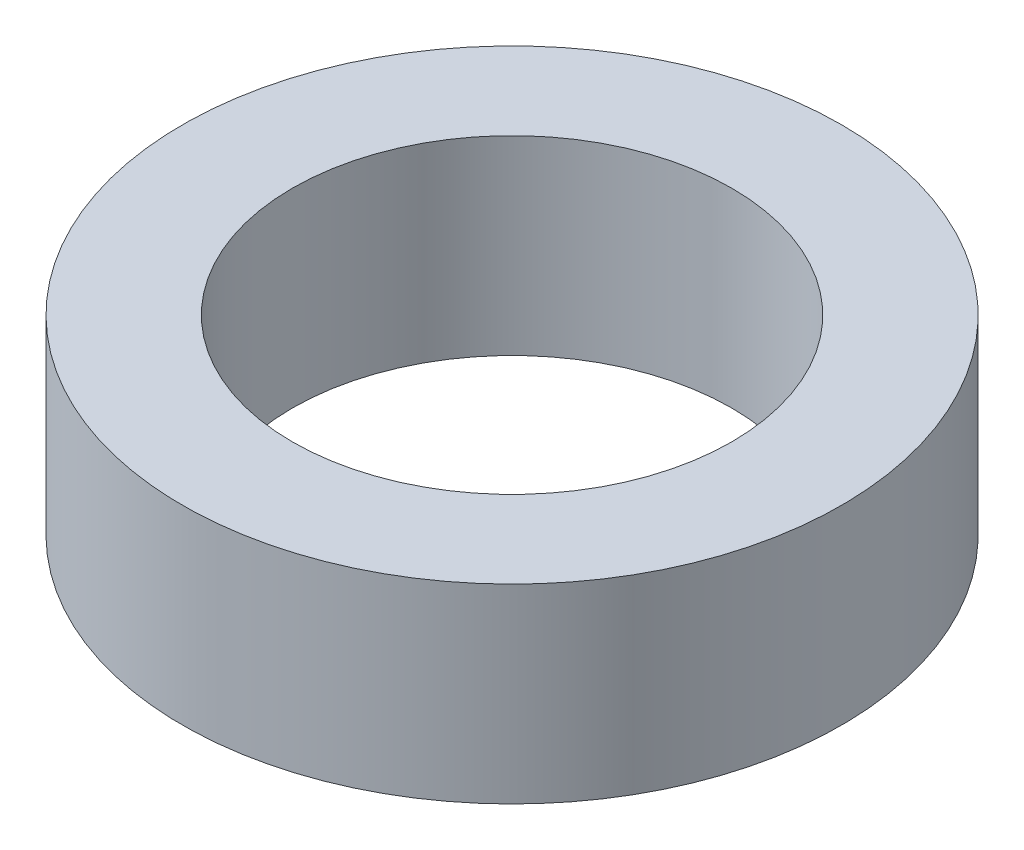
from build123d import *

# Parameters (mm, degrees)
SKETCH1_R           = 22.5
BOSS_EXTRUDE1_DEPTH = 13
SKETCH2_R           = 15
CUT_EXTRUDE1_DEPTH  = 35.372954485


with BuildPart() as part:
    # Sketch1 → Boss-Extrude1 (new body)
    with BuildSketch(Plane(origin=(0, 0, 0), x_dir=(1, 0, 0), z_dir=(0, 1, 0))):
        Circle(SKETCH1_R)
    extrude(amount=BOSS_EXTRUDE1_DEPTH)

    # Sketch2 → Cut-Extrude1 (cut, through all)
    with BuildSketch(Plane(origin=(0, 0, 0), x_dir=(1, 0, 0), z_dir=(0, 1, 0))):
        Circle(SKETCH2_R)
    extrude(amount=CUT_EXTRUDE1_DEPTH, mode=Mode.SUBTRACT)


solid = part.part
